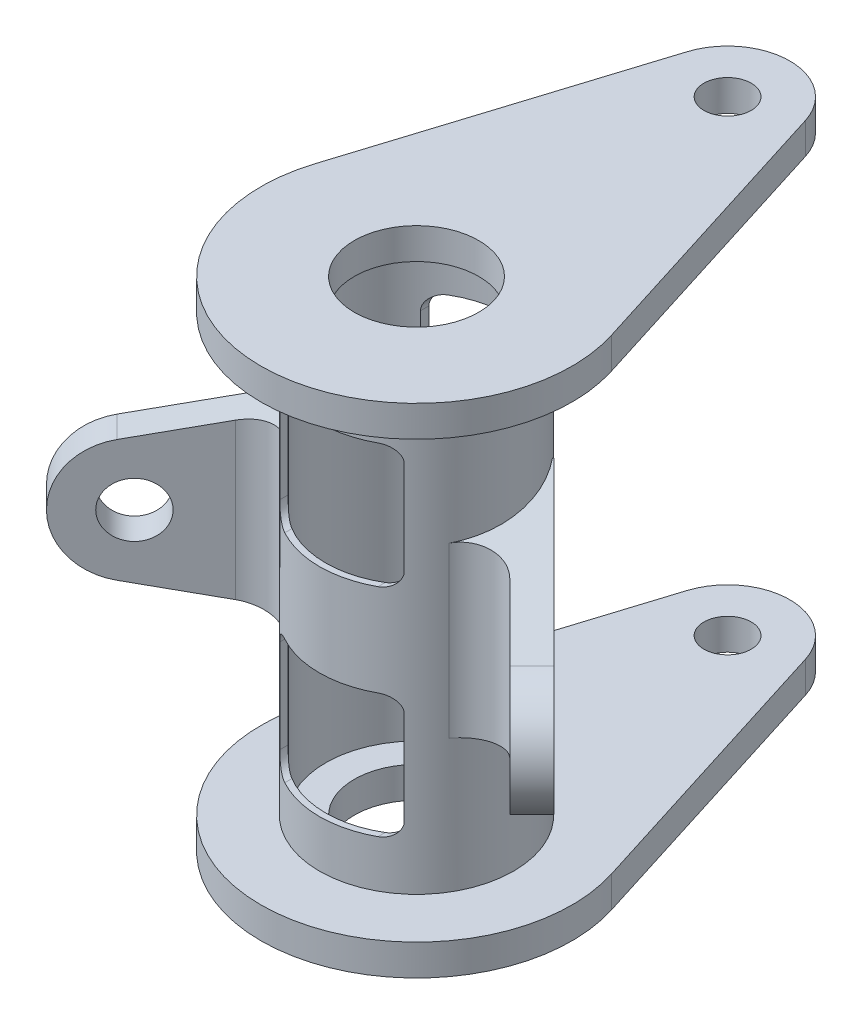
from build123d import *
from build123d.topology import SkipClean

# Parameters (mm, degrees)
SALIENTE_EXTRUIR1_DEPTH    = 6.35
CROQUIS2_R                 = 19.812
SALIENTE_EXTRUIR2_DEPTH    = 44.449999999999996
SALIENTE_EXTRUIR3_START    = -20.574
SALIENTE_EXTRUIR3_DEPTH    = 20.574
CROQUIS4_R                 = 5.588
CORTAR_EXTRUIR1_DEPTH      = 20.574
SALIENTE_EXTRUIR4_START    = -44.449999999999996
CROQUIS5_R                 = 19.812
SALIENTE_EXTRUIR4_DEPTH    = 44.449999999999996
SIMETR_A3_START            = -19.812
SIMETR_A3_DEPTH            = 39.624
SIMETR_A3_START_2          = -54
SIMETR_A3_2_DEPTH          = 34.1879999
SIMETR_A3_START_3          = 5.908204962
SIMETR_A3_3_DEPTH          = 13.903795038
SIMETR_A3_START_4          = -19.052465903
SIMETR_A3_4_DEPTH          = 12.261840878
SIMETR_A3_START_5          = -2.620263604
SIMETR_A3_5_DEPTH          = 15.959798001
SIMETR_A3_START_6          = 50.8
SIMETR_A3_6_DEPTH          = 36.059618
SIMETR_A3_7_OUTLINE_R      = 19.812
SIMETR_A3_7_DEPTH          = 44.45
CROQUIS6_R                 = 12.7
CROQUIS6_R_2               = 4.825999999999996
CORTAR_EXTRUIR2_DEPTH      = 138.1513113910431
CORTAR_EXTRUIR3_DEPTH      = 138.1513113910431
CORTAR_EXTRUIR3_DEPTH_BACK = 138.1513113910431
CORTAR_REVOLUCI_N4_ANGLE   = 7.600000000000017
CROQUIS9_R                 = 18.541999999999998
CORTAR_EXTRUIR4_DEPTH      = 44.449999999999996


with BuildPart() as part:
    # Croquis1 → Saliente-Extruir1 (new body)
    with BuildSketch(Plane(origin=(0, 0, 0), x_dir=(1, 0, 0), z_dir=(0, 1, 0))):
        with BuildLine():
            Line((-12.115027857995218, 67.31), (-30.28756964498803, 9.524999999999999))
            ThreePointArc((-30.28756964498803, 9.524999999999999), (-5.83e-15, -31.750000000000004), (30.28756964498803, 9.525000000000002))
            Line((30.28756964498803, 9.525000000000002), (12.115027857995216, 67.31))
            ThreePointArc((12.115027857995216, 67.31), (-3.87e-15, 76.20000000000002), (-12.115027857995218, 67.31))
        make_face()
    saliente_extruir1 = extrude(amount=SALIENTE_EXTRUIR1_DEPTH)

    # Croquis2 → Saliente-Extruir2 (add)
    with BuildSketch(Plane(origin=(0, 6.35, 0), x_dir=(1, 0, 0), z_dir=(0, 1, 0))):
        with Locations(Location((0, 0, 0), (0, 0, 270))):
            Circle(CROQUIS2_R)
    extrude(amount=SALIENTE_EXTRUIR2_DEPTH)

    # Croquis3 → Saliente-Extruir3 (add)
    with BuildSketch(Plane(origin=(0, 50.8, 0), x_dir=(1, 0, 0), z_dir=(0, 1, 0)).offset(SALIENTE_EXTRUIR3_START)):
        with BuildLine():
            Line((-47.292902135334636, -28.254759158668445), (-28.02014275461402, -8.981999777947628))
            ThreePointArc((-28.02014275461402, -8.981999777947628), (-22.146541916361613, -6.949279247516247), (-16.91805233482633, -10.309939340077479))
            ThreePointArc((-16.91805233482633, -10.309939340077479), (19.784469920055887, -1.044075659329214), (-15.73894246204769, 12.03333013659778))
            Line((-15.73894246204769, 12.03333013659778), (-15.862005711592825, 12.156393386142913))
            Line((-15.862005711592825, 12.156393386142913), (-51.78303019586924, -23.76463109813389))
            Line((-51.78303019586924, -23.76463109813389), (-47.292902135334636, -28.254759158668445))
        make_face()
    saliente_extruir3 = extrude(amount=SALIENTE_EXTRUIR3_DEPTH)

    # Croquis4 → Cortar-Extruir1 (cut)
    with BuildSketch(Plane(origin=(-14.009199548867954, 0, -14.009199548867802), x_dir=(-0.7071067811865438, 0, 0.7071067811865513), z_dir=(-0.7071067811865513, 0, -0.7071067811865438))):
        with Locations((40.720263603773965, 50.8)):
            Circle(CROQUIS4_R)
        with BuildLine():
            Line((2.6202636037739606, 30.225999999999996), (43.21167318801615, 38.34677237486015))
            ThreePointArc((43.21167318801615, 38.34677237486015), (50.54194629361575, 42.74863060466966), (53.42026360377396, 50.8))
            Line((53.42026360377396, 50.8), (53.42026360377396, 30.225999999999996))
            Line((53.42026360377396, 30.225999999999996), (2.6202636037739606, 30.225999999999996))
        make_face()
    cortar_extruir1 = extrude(amount=-CORTAR_EXTRUIR1_DEPTH, mode=Mode.SUBTRACT)

    # Simetría1: Saliente-Extruir3, Cortar-Extruir1 across plane
    add(saliente_extruir3.mirror(Plane(origin=(0, 0, 0), x_dir=(0, 0, 1), z_dir=(1, 0, 0))))
    add(cortar_extruir1.mirror(Plane(origin=(0, 0, 0), x_dir=(0, 0, 1), z_dir=(1, 0, 0))), mode=Mode.SUBTRACT)

    # Croquis5 → Saliente-Extruir4 (add)
    with BuildSketch(Plane(origin=(0, 50.8, 0), x_dir=(1, 0, 0), z_dir=(0, 1, 0)).offset(SALIENTE_EXTRUIR4_START)):
        with Locations(Location((0, 0, 0), (0, 0, 37.4))):
            Circle(CROQUIS5_R)
    extrude(amount=SALIENTE_EXTRUIR4_DEPTH)

    # Simetría3: read off the stored shape, not the designer's step
    # Simetría3 outline → Simetría3 (add)
    with BuildSketch(Plane(origin=(0, 0, 0), x_dir=(0.7071067811865438, 0, -0.7071067811865512), z_dir=(0.7071067811865511, 0, 0.7071067811865441)).offset(SIMETR_A3_START)):
        with BuildLine():
            Line((-35.132263604, 50.8), (-2.620263604, 50.8))
            Line((-2.620263604, 50.8), (-2.620263604, 71.374))
            Line((-2.620263604, 71.374), (-43.211673188, 63.253227625))
            ThreePointArc((-43.211673188, 63.253227625), (-50.541946294, 58.851369395), (-53.420263604, 50.8))
            Line((-53.420263604, 50.8), (-46.308263604, 50.8))
            ThreePointArc((-46.308263604, 50.8), (-40.720263604, 56.388), (-35.132263604, 50.8))
        make_face()
    extrude(amount=SIMETR_A3_DEPTH)

    # Simetr_a3 2 outline → Simetr_a3 2 (cut)
    with BuildSketch(Plane(origin=(0, 0, 0), x_dir=(0.7071067811865438, 0, 0.7071067811865512), z_dir=(0.7071067811865511, 0, -0.7071067811865441)).offset(SIMETR_A3_START_2)):
        Polygon((2.620263604, -71.374), (19.812, -67.934597934), (19.812, -50.8), (2.620263604, -50.8), align=None)
    extrude(amount=SIMETR_A3_2_DEPTH, mode=Mode.SUBTRACT)

    # Simetr_a3 3 outline → Simetr_a3 3 (add)
    with SkipClean():  # the faces are left unmerged after this step: merging them gives an invalid solid
        with BuildSketch(Plane(origin=(0, 0, 0), x_dir=(0.7071067811865438, 0, 0.7071067811865512), z_dir=(0.7071067811865511, 0, -0.7071067811865441)).offset(SIMETR_A3_START_3)):
            with BuildLine():
                ThreePointArc((43.211673188, -63.253227625), (50.541946294, -58.851369395), (53.420263604, -50.8))
                Line((53.420263604, -50.8), (46.308263604, -50.8))
                ThreePointArc((46.308263604, -50.8), (40.720263604, -56.388), (35.132263604, -50.8))
                Line((35.132263604, -50.8), (2.620263604, -50.8))
                Line((2.620263604, -50.8), (2.620263604, -71.374))
                Line((2.620263604, -71.374), (43.211673188, -63.253227625))
            make_face()
        extrude(amount=SIMETR_A3_3_DEPTH)

    # Simetr_a3 4 outline → Simetr_a3 4 (add)
    with SkipClean():  # the faces are left unmerged after this step: merging them gives an invalid solid
        with BuildSketch(Plane(origin=(0, 0, 0), x_dir=(0.7071067811865438, 0, 0.7071067811865512), z_dir=(0.7071067811865511, 0, -0.7071067811865441)).offset(SIMETR_A3_START_4)):
            Polygon((2.620263604, -71.374), (19.812, -67.934597934), (19.812, -50.8), (2.620263604, -50.8), align=None)
        extrude(amount=SIMETR_A3_4_DEPTH)

    # Simetr_a3 5 outline → Simetr_a3 5 (add)
    with SkipClean():  # the faces are left unmerged after this step: merging them gives an invalid solid
        with BuildSketch(Plane(origin=(0, 0, 0), x_dir=(0.7071067811865438, 0, 0.7071067811865512), z_dir=(0.7071067811865511, 0, -0.7071067811865441)).offset(SIMETR_A3_START_5)):
            Polygon((2.620263604, -71.374), (19.812, -67.934597934), (19.812, -50.8), (2.620263604, -50.8), align=None)
        extrude(amount=SIMETR_A3_5_DEPTH)

    # Simetr_a3 6 outline → Simetr_a3 6 (cut)
    with BuildSketch(Plane(origin=(0, 0, 0), x_dir=(1, 0, 0), z_dir=(0, 1, 0)).offset(SIMETR_A3_START_6)):
        with BuildLine():
            Line((14.009199421, -14.009199677), (18.186931342, -9.831467756))
            Line((18.186931342, -9.831467756), (49, -40.644536414))
            Line((49, -40.644536414), (49, -29.961857024))
            Line((49, -29.961857024), (47.292902135, -28.254759159))
            Line((47.292902135, -28.254759159), (28.020142755, -8.981999778))
            ThreePointArc((28.020142755, -8.981999778), (22.146541917, -6.949279248), (16.918052335, -10.30993934))
            ThreePointArc((16.918052335, -10.30993934), (15.573851709, -12.246243789), (14.009199421, -14.009199677))
        make_face()
        with BuildLine():
            ThreePointArc((14.009199421, -14.009199677), (-2.352974305, -19.671778159), (-16.918052335, -10.30993934))
            ThreePointArc((-16.918052335, -10.30993934), (-22.146541917, -6.949279248), (-28.020142755, -8.981999778))
            Line((-28.020142755, -8.981999778), (-47.292902135, -28.254759159))
            Line((-47.292902135, -28.254759159), (-49, -29.961857024))
            Line((-49, -29.961857024), (-49, -41))
            Line((-49, -41), (-37.294387674, -41))
            Line((-37.294387674, -41), (-35.921024484, -39.62663681))
            Line((-35.921024484, -39.62663681), (-12.156393457, -15.862005782))
            Line((-12.156393457, -15.862005782), (-7.1e-08, -28.018399168))
            Line((-7.1e-08, -28.018399168), (14.009199421, -14.009199677))
        make_face()
    extrude(amount=SIMETR_A3_6_DEPTH, mode=Mode.SUBTRACT)

    # Simetr_a3 7 outline → Simetr_a3 7 (add)
    with BuildSketch(Plane(origin=(0, 0, 0), x_dir=(1, 0, 0), z_dir=(0, 1, 0)).offset(SIMETR_A3_START_6)):
        Circle(SIMETR_A3_7_OUTLINE_R)
    extrude(amount=SIMETR_A3_7_DEPTH)

    # Simetría4: Saliente-Extruir1 across plane
    add(saliente_extruir1.mirror(Plane.ZX.offset(50.8)))

    # Croquis6 → Cortar-Extruir2 (cut, through all)
    with BuildSketch(Plane(origin=(0, 101.6, 0), x_dir=(1, 0, 0), z_dir=(0, 1, 0))):
        with Locations(Location((0, 0, 0), (0, 0, 270))):
            Circle(CROQUIS6_R)
        with Locations(Location((-7.47e-15, 63.5, 0), (0, 0, 270))):
            Circle(CROQUIS6_R_2)
    extrude(amount=-CORTAR_EXTRUIR2_DEPTH, mode=Mode.SUBTRACT)

    # Croquis7 → Cortar-Extruir3 (cut, two sides: drawn at the far end of the back side and taken through both)
    with SkipClean():  # the faces are left unmerged after this step: merging them gives an invalid solid
        with BuildSketch(Plane.XY.offset(-CORTAR_EXTRUIR3_DEPTH_BACK)):
            with BuildLine():
                Line((-9.524999999999977, 85.59800000000001), (9.524999999999977, 85.59800000000001))
                ThreePointArc((9.524999999999977, 85.59800000000001), (11.770064030267289, 84.6680640302673), (12.7, 82.42299999999999))
                Line((12.7, 82.42299999999999), (12.700000000000005, 63.373000000000026))
                ThreePointArc((12.700000000000005, 63.373000000000026), (11.770064030267292, 61.12793596973272), (9.52499999999998, 60.19800000000001))
                Line((9.52499999999998, 60.19800000000001), (-9.524999999999974, 60.19800000000001))
                ThreePointArc((-9.524999999999974, 60.19800000000001), (-11.770064030267282, 61.12793596973272), (-12.699999999999996, 63.373000000000026))
                Line((-12.699999999999996, 63.373000000000026), (-12.7, 82.42299999999999))
                ThreePointArc((-12.7, 82.42299999999999), (-11.770064030267289, 84.6680640302673), (-9.524999999999977, 85.59800000000001))
            make_face()
            with BuildLine():
                Line((12.7, 19.177000000000014), (12.700000000000005, 38.22699999999997))
                ThreePointArc((12.700000000000005, 38.22699999999997), (11.770064030267292, 40.472064030267276), (9.52499999999998, 41.40199999999999))
                Line((9.52499999999998, 41.40199999999999), (-9.524999999999974, 41.40199999999999))
                ThreePointArc((-9.524999999999974, 41.40199999999999), (-11.770064030267282, 40.472064030267276), (-12.699999999999996, 38.22699999999997))
                Line((-12.699999999999996, 38.22699999999997), (-12.7, 19.177000000000014))
                ThreePointArc((-12.7, 19.177000000000014), (-11.770064030267289, 16.931935969732702), (-9.524999999999977, 16.00199999999999))
                Line((-9.524999999999977, 16.00199999999999), (9.524999999999977, 16.00199999999999))
                ThreePointArc((9.524999999999977, 16.00199999999999), (11.770064030267289, 16.931935969732702), (12.7, 19.177000000000014))
            make_face()
        extrude(amount=CORTAR_EXTRUIR3_DEPTH + CORTAR_EXTRUIR3_DEPTH_BACK, mode=Mode.SUBTRACT)

    # Croquis8 → Cortar-Revolución4 (revolve, cut)
    with SkipClean():  # the faces are left unmerged after this step: merging them gives an invalid solid
        with BuildSketch(Plane(origin=(-14.009199548867954, 0, -14.009199548867802), x_dir=(-0.7071067811865438, 0, 0.7071067811865513), z_dir=(-0.7071067811865513, 0, -0.7071067811865438))):
            with BuildLine():
                Line((2.6202636037739606, 61.086999999999996), (2.6202636037739593, 50.79999999999999))
                Line((2.6202636037739593, 50.79999999999999), (2.6202636037739624, 40.51299999999999))
                Line((2.6202636037739624, 40.51299999999999), (10.850490800348375, 43.06437043093806))
                ThreePointArc((10.850490800348375, 43.06437043093806), (14.082109781929535, 45.362454914874306), (15.320263603773961, 49.12961945214584))
                Line((15.320263603773961, 49.12961945214584), (15.320263603773961, 50.79999999999999))
                Line((15.320263603773961, 50.79999999999999), (15.320263603773965, 52.47038054785414))
                ThreePointArc((15.320263603773965, 52.47038054785414), (14.082109781929542, 56.237545085125674), (10.850490800348377, 58.535629569061925))
                Line((10.850490800348377, 58.535629569061925), (2.6202636037739606, 61.086999999999996))
            make_face()
        cortar_revoluci_n4 = revolve(axis=Axis((-15.862005711592815, 30.225999999999996, -12.156393386142923), (0, 1, 0)), revolution_arc=CORTAR_REVOLUCI_N4_ANGLE, mode=Mode.SUBTRACT)

    # Simetría5: Cortar-Revolución4 across plane
    with SkipClean():  # the faces are left unmerged after this step: merging them gives an invalid solid
        add(cortar_revoluci_n4.mirror(Plane(origin=(0, 0, 0), x_dir=(0, 0, 1), z_dir=(1, 0, 0))), mode=Mode.SUBTRACT)

    # Croquis9 → Cortar-Extruir4 (cut, symmetric)
    with SkipClean():  # the faces are left unmerged after this step: merging them gives an invalid solid
        with BuildSketch(Plane(origin=(0, 50.8, 0), x_dir=(1, 0, 0), z_dir=(0, 1, 0))):
            with Locations(Location((0, 0, 0), (0, 0, 270))):
                Circle(CROQUIS9_R)
        extrude(amount=CORTAR_EXTRUIR4_DEPTH, both=True, mode=Mode.SUBTRACT)


solid = part.part
